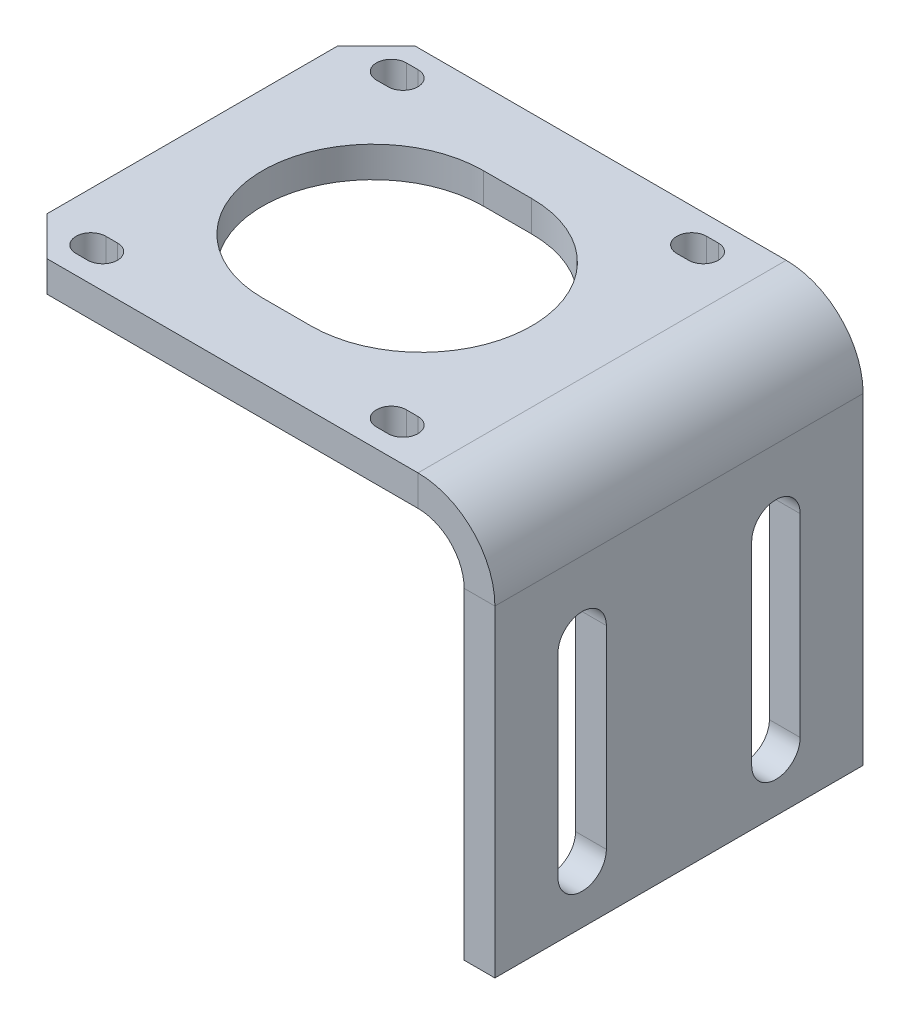
from build123d import *

# Parameters (mm, degrees)
SKETCH1_W                    = 38
SKETCH1_H                    = 38
BASE_FLANGE1_DEPTH           = 3.175
EDGE_FLANGE1_STRIP_W         = 22.225
EDGE_FLANGE1_STRIP_H         = 3.175
EDGE_FLANGE1_STRIP_CUT_DEPTH = 38
EDGE_FLANGE1_DEPTH           = 38
EDGE_FLANGE1_START           = 3.175
EDGE_FLANGE1_PROFILE_W       = 38
EDGE_FLANGE1_PROFILE_H       = 42.3
EDGE_FLANGE1_FLAT_DEPTH      = 3.175
CHAMFER1_SIZE                = 4
CUT_EXTRUDE1_DEPTH           = 10


# Sheet-metal steps are written as plain solids
with BuildPart() as part:
    # Sketch1 → Base-Flange1 (new body)
    with BuildSketch(Plane.ZY.offset(-22.559027455)):
        with Locations((229.809714632, 54.911820509)):
            Rectangle(SKETCH1_W, SKETCH1_H)
    extrude(amount=BASE_FLANGE1_DEPTH)

    # Edge-Flange1 strip (across the edge) → Edge-Flange1 strip cut (cut)
    with BuildSketch(Plane(origin=(19.384027455, 73.911820509, 248.809714632), x_dir=(0, -1, 0), z_dir=(0, 0, -1))):
        with Locations((-6.35, -1.5875)):
            Rectangle(EDGE_FLANGE1_STRIP_W, EDGE_FLANGE1_STRIP_H)
    extrude(amount=EDGE_FLANGE1_STRIP_CUT_DEPTH, mode=Mode.SUBTRACT)

    # Edge-Flange1 bend section (across the edge) → Edge-Flange1 (add)
    with BuildSketch(Plane(origin=(19.384027455, 73.911820509, 248.809714632), x_dir=(0, -1, 0), z_dir=(0, 0, -1))):
        with BuildLine():
            Line((-3.175, 4.7625), (0, 4.7625))
            ThreePointArc((0, 4.7625), (1.394903955, 1.394903955), (4.7625, 0))
            Line((4.7625, 0), (4.7625, -3.175))
            ThreePointArc((4.7625, -3.175), (-0.850160076, -0.850160076), (-3.175, 4.7625))
        make_face()
    extrude(amount=EDGE_FLANGE1_DEPTH)

    # Edge-Flange1 profile (on flange) → Edge-Flange1 flat (add)
    with BuildSketch(Plane(origin=(19.384027455, 73.911820509, 0), x_dir=(0, 0, -1), z_dir=(0, 1, 0)).offset(EDGE_FLANGE1_START)):
        with Locations((-229.809714632, 25.9125)):
            Rectangle(EDGE_FLANGE1_PROFILE_W, EDGE_FLANGE1_PROFILE_H)
        with BuildLine():
            Line((-246.850058636, 9.810559352), (-246.850058636, 11.014440648))
            ThreePointArc((-246.850058636, 11.014440648), (-245.309714632, 12.554784652), (-243.769370628, 11.014440648))
            Line((-243.769370628, 11.014440648), (-243.769370628, 9.810559352))
            ThreePointArc((-243.769370628, 9.810559352), (-245.309714632, 8.270215348), (-246.850058636, 9.810559352))
        make_face(mode=Mode.SUBTRACT)
        with BuildLine():
            Line((-215.850058636, 9.810559352), (-215.850058636, 11.014440648))
            ThreePointArc((-215.850058636, 11.014440648), (-214.309714632, 12.554784652), (-212.769370628, 11.014440648))
            Line((-212.769370628, 11.014440648), (-212.769370628, 9.810559352))
            ThreePointArc((-212.769370628, 9.810559352), (-214.309714632, 8.270215348), (-215.850058636, 9.810559352))
        make_face(mode=Mode.SUBTRACT)
        with BuildLine():
            Line((-241.197832947, 23.4125), (-241.197832947, 28.4125))
            ThreePointArc((-241.197832947, 28.4125), (-229.809714632, 39.800618315), (-218.421596317, 28.4125))
            Line((-218.421596317, 28.4125), (-218.421596317, 23.4125))
            ThreePointArc((-218.421596317, 23.4125), (-229.809714632, 12.024381685), (-241.197832947, 23.4125))
        make_face(mode=Mode.SUBTRACT)
        with BuildLine():
            Line((-246.850058636, 40.810559352), (-246.850058636, 42.014440648))
            ThreePointArc((-246.850058636, 42.014440648), (-245.309714632, 43.554784652), (-243.769370628, 42.014440648))
            Line((-243.769370628, 42.014440648), (-243.769370628, 40.810559352))
            ThreePointArc((-243.769370628, 40.810559352), (-245.309714632, 39.270215348), (-246.850058636, 40.810559352))
        make_face(mode=Mode.SUBTRACT)
        with BuildLine():
            Line((-215.850058636, 40.810559352), (-215.850058636, 42.014440648))
            ThreePointArc((-215.850058636, 42.014440648), (-214.309714632, 43.554784652), (-212.769370628, 42.014440648))
            Line((-212.769370628, 42.014440648), (-212.769370628, 40.810559352))
            ThreePointArc((-212.769370628, 40.810559352), (-214.309714632, 39.270215348), (-215.850058636, 40.810559352))
        make_face(mode=Mode.SUBTRACT)
    extrude(amount=-EDGE_FLANGE1_FLAT_DEPTH)

    # Chamfer1
    chamfer1_edges = [part.edges().sort_by_distance(p)[0] for p in [
        (-27.678472545, 75.499320509, 248.809714632),
        (-27.678472545, 75.499320509, 210.809714632),
    ]]
    chamfer(chamfer1_edges, length=CHAMFER1_SIZE)

    # Sketch9 → Cut-Extrude1 (cut)
    with BuildSketch(Plane.ZY.offset(-19.384027455)):
        with BuildLine():
            Line((242.309714632, 61.660898278), (242.309714632, 41.660898278))
            ThreePointArc((242.309714632, 41.660898278), (239.809714632, 39.160898278), (237.309714632, 41.660898278))
            Line((237.309714632, 41.660898278), (237.309714632, 61.660898278))
            ThreePointArc((237.309714632, 61.660898278), (239.809714632, 64.160898278), (242.309714632, 61.660898278))
        make_face()
        with BuildLine():
            Line((222.309714633, 61.660898278), (222.309714633, 41.660898278))
            ThreePointArc((222.309714633, 41.660898278), (219.809714633, 39.160898278), (217.309714633, 41.660898278))
            Line((217.309714633, 41.660898278), (217.309714633, 61.660898278))
            ThreePointArc((217.309714633, 61.660898278), (219.809714633, 64.160898278), (222.309714633, 61.660898278))
        make_face()
    extrude(amount=-CUT_EXTRUDE1_DEPTH, mode=Mode.SUBTRACT)


solid = part.part
